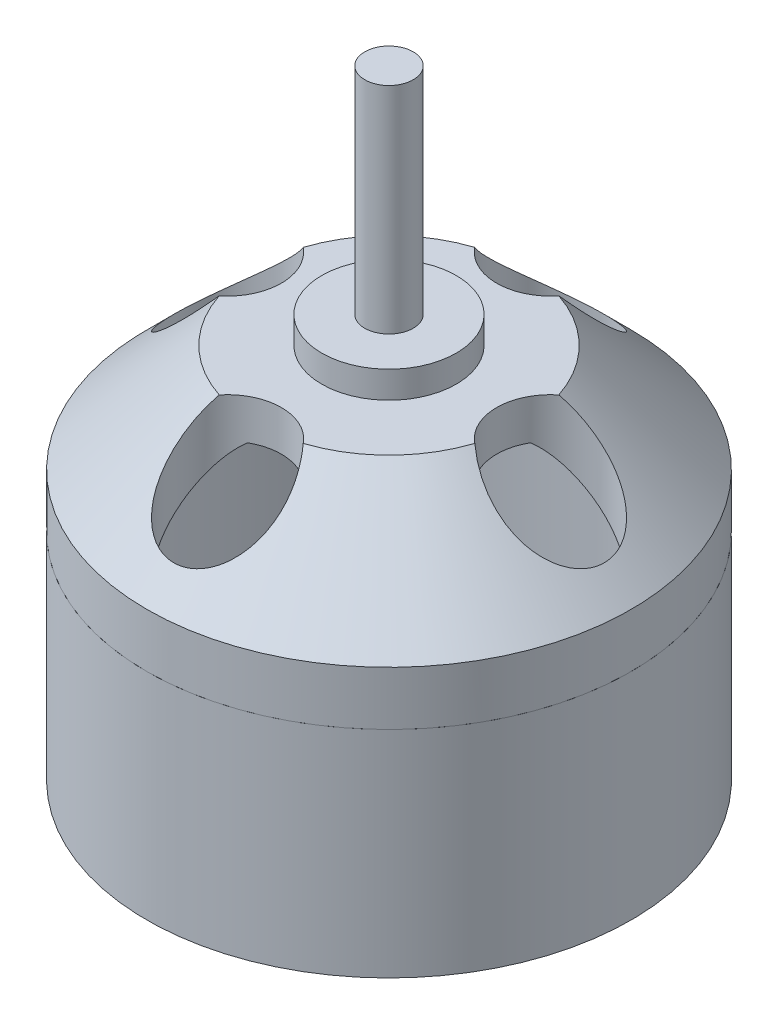
from build123d import *

# Parameters (mm, degrees)
IZIM2_R                          = 9
Y_KSEKLIK_EKSTR_ZYON1_DEPTH      = 1
IZIM3_R                          = 9
Y_KSEKLIK_EKSTR_ZYON2_DEPTH      = 5
PAH1_SIZE                        = 4
BO_ALTMA1_T                      = -1.5
IZIM5_R                          = 2
KES_EKSTR_ZYON1_DEPTH            = 6
IZIM7_R                          = 2.5
Y_KSEKLIK_EKSTR_ZYON4_DEPTH      = 1
IZIM6_R                          = 9
IZIM6_R_2                        = 8.5
Y_KSEKLIK_EKSTR_ZYON6_DEPTH      = 8
Y_KSEKLIK_EKSTR_ZYON7_DEPTH      = 8
Y_KSEKLIK_EKSTR_ZYON7_DEPTH_BACK = 20
IZIM8_R                          = 0.9


with BuildPart() as part:
    # Çizim2 → Yükseklik-Ekstrüzyon1 (new body)
    with BuildSketch(Plane(origin=(0, 0, 0), x_dir=(1, 0, 0), z_dir=(0, 1, 0))):
        Circle(IZIM2_R)
    extrude(amount=Y_KSEKLIK_EKSTR_ZYON1_DEPTH)

    # Çizim3 → Yükseklik-Ekstrüzyon2 (add)
    with BuildSketch(Plane(origin=(0, 1, 0), x_dir=(1, 0, 0), z_dir=(0, 1, 0))):
        Circle(IZIM3_R)
    extrude(amount=Y_KSEKLIK_EKSTR_ZYON2_DEPTH)

    # Pah1
    pah1_edges = [part.edges().sort_by_distance(p)[0] for p in [
        (-9, 6, 0),
    ]]
    chamfer(pah1_edges, length=PAH1_SIZE)

    # İç Boşaltma1
    bo_altma1_openings = [part.faces().sort_by_distance(p)[0] for p in [
        (0, 0, 0),
    ]]
    offset(amount=BO_ALTMA1_T, openings=bo_altma1_openings, kind=Kind.INTERSECTION)

    # Çizim5 → Kes-Ekstrüzyon1 (cut)
    with BuildSketch(Plane(origin=(0, 6, 0), x_dir=(1, 0, 0), z_dir=(0, 1, 0))):
        with Locations((0, -6)):
            Circle(IZIM5_R)
        with Locations((-6, 0)):
            Circle(IZIM5_R)
        with Locations((0, 6)):
            Circle(IZIM5_R)
        with Locations((6, 0)):
            Circle(IZIM5_R)
    extrude(amount=-KES_EKSTR_ZYON1_DEPTH, mode=Mode.SUBTRACT)

    # Çizim7 → Yükseklik-Ekstrüzyon4 (add)
    with BuildSketch(Plane(origin=(0, 6, 0), x_dir=(1, 0, 0), z_dir=(0, 1, 0))):
        Circle(IZIM7_R)
    extrude(amount=Y_KSEKLIK_EKSTR_ZYON4_DEPTH)


with BuildPart() as body_2:
    # Çizim6 → Yükseklik-Ekstrüzyon6 (new body)
    with BuildSketch(Plane.XZ):
        Circle(IZIM6_R)
        Circle(IZIM6_R_2, mode=Mode.SUBTRACT)
    extrude(amount=Y_KSEKLIK_EKSTR_ZYON6_DEPTH)


with BuildPart() as body_3:
    # Çizim8 → Yükseklik-Ekstrüzyon7 (new, two sides: drawn at the far end of the back side and taken through both)
    with BuildSketch(Plane(origin=(0, 7, 0), x_dir=(1, 0, 0), z_dir=(0, 1, 0)).offset(-Y_KSEKLIK_EKSTR_ZYON7_DEPTH_BACK)):
        Circle(IZIM8_R)
    extrude(amount=Y_KSEKLIK_EKSTR_ZYON7_DEPTH + Y_KSEKLIK_EKSTR_ZYON7_DEPTH_BACK)


solid = Compound([part.part, body_2.part, body_3.part])
